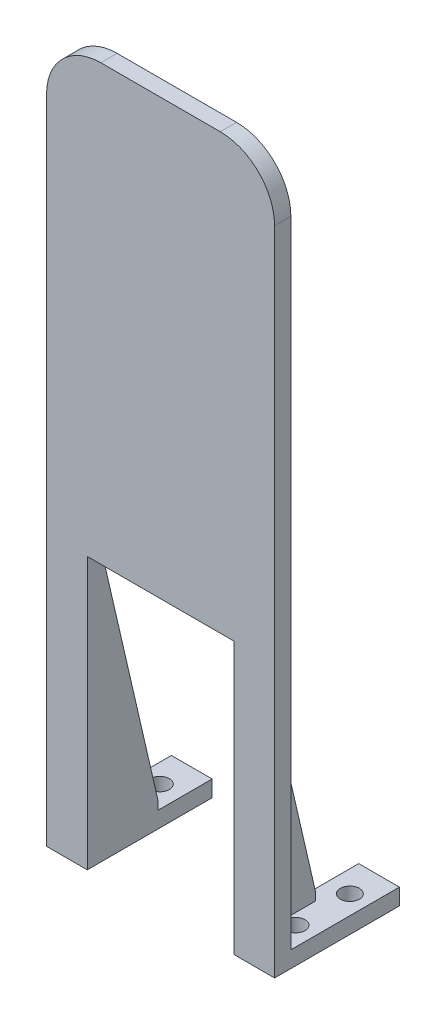
from build123d import *
from OCP.BRepFilletAPI import BRepFilletAPI_MakeChamfer

# Parameters (mm, degrees)
SKETCH1_W           = 42
SKETCH1_H           = 130
BOSS_EXTRUDE1_DEPTH = 3
SKETCH2_W           = 27
SKETCH2_H           = 100
CUT_EXTRUDE1_DEPTH  = 3
BOSS_EXTRUDE2_DEPTH = 10
CHAMFER1_SIZE       = 43.314758743
CHAMFER1_SIZE_2     = 10
SKETCH5_R           = 1.75
CUT_EXTRUDE2_DEPTH  = 10
SKETCH6_W           = 7.5
SKETCH6_H           = 3
BOSS_EXTRUDE3_DEPTH = 10
LPATTERN1_COUNT     = 2
LPATTERN1_PITCH     = 10
FILLET1_R           = 10


with BuildPart() as part:
    # Sketch1 → Boss-Extrude1 (new body)
    with BuildSketch(Plane.XY):
        Rectangle(SKETCH1_W, SKETCH1_H)
    extrude(amount=BOSS_EXTRUDE1_DEPTH)

    # Sketch2 → Cut-Extrude1 (cut)
    with BuildSketch(Plane.XY.offset(3)):
        with Locations((0, -65)):
            Rectangle(SKETCH2_W, SKETCH2_H)
    extrude(amount=-CUT_EXTRUDE1_DEPTH, mode=Mode.SUBTRACT)

    # Sketch3 → Boss-Extrude2 (add)
    with BuildSketch(Plane(origin=(0, 0, 0), x_dir=(-1, 0, 0), z_dir=(0, 0, -1))):
        Polygon((-21, -65), (-13.5, -65), (-13.5, -62), (-13.5, -17), (-15.5, -17), (-15.5, -62), (-21, -62), align=None)
        Polygon((13.5, -65), (21, -65), (21, -62), (15.5, -62), (15.5, -17), (13.5, -17), (13.5, -62), align=None)
    extrude(amount=BOSS_EXTRUDE2_DEPTH)

    # Chamfer1
    chamfer1_edges_1 = [part.edges().sort_by_distance(p)[0] for p in [
        (-14.5, -17, -10),
    ]]
    chamfer1_side_1 = [part.faces().sort_by_distance(p)[0] for p in [
        (-14.5, -17.2, -10),
    ]]
    chamfer1_edges_2 = [part.edges().sort_by_distance(p)[0] for p in [
        (14.5, -17, -10),
    ]]
    chamfer1_side_2 = [part.faces().sort_by_distance(p)[0] for p in [
        (14.5, -17.2, -10),
    ]]
    chamfer1 = BRepFilletAPI_MakeChamfer(part.part.solid().wrapped)
    for e in chamfer1_edges_1:
        chamfer1.Add(CHAMFER1_SIZE - 0.0001, CHAMFER1_SIZE_2 - 0.0001, e.wrapped, chamfer1_side_1[0].wrapped)
    for e in chamfer1_edges_2:
        chamfer1.Add(CHAMFER1_SIZE - 0.0001, CHAMFER1_SIZE_2 - 0.0001, e.wrapped, chamfer1_side_2[0].wrapped)
    add(Compound.cast(chamfer1.Shape()), mode=Mode.REPLACE)  # a hair under: the kernel refuses the full size

    # Sketch5 → Cut-Extrude2 (cut)
    with BuildSketch(Plane.XZ.offset(65)):
        with Locations(Location((-17.5, -4.36859694, 0), (0, 0, 270))):
            Circle(SKETCH5_R)
        with Locations(Location((17.5, -4.36859694, 0), (0, 0, 270))):
            Circle(SKETCH5_R)
    cut_extrude2 = extrude(amount=-CUT_EXTRUDE2_DEPTH, mode=Mode.SUBTRACT)

    # Sketch6 → Boss-Extrude3 (add)
    with BuildSketch(Plane(origin=(0, 0, -10), x_dir=(-1, 0, 0), z_dir=(0, 0, -1))):
        with Locations((17.25, -63.5)):
            Rectangle(SKETCH6_W, SKETCH6_H)
        with Locations((-17.25, -63.5)):
            Rectangle(SKETCH6_W, SKETCH6_H)
    extrude(amount=BOSS_EXTRUDE3_DEPTH)

    # LPattern1: Cut-Extrude2 ×2
    with Locations(*[(0, 0, -i * LPATTERN1_PITCH) for i in range(1, LPATTERN1_COUNT)]):
        add(cut_extrude2, mode=Mode.SUBTRACT)

    # Fillet1
    fillet1_edges = [part.edges().sort_by_distance(p)[0] for p in [
        (-21, 65, 1.5),
        (21, 65, 1.5),
    ]]
    fillet(fillet1_edges, radius=FILLET1_R)


solid = part.part
